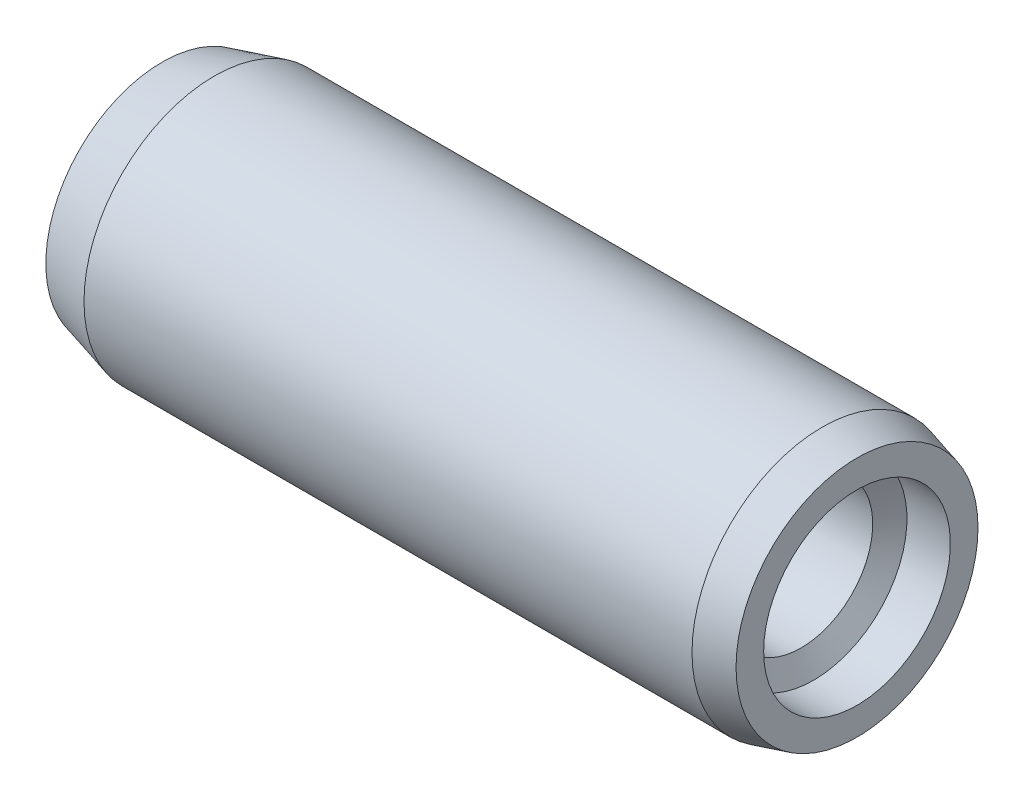
from build123d import *


with BuildPart() as part:
    # Sketch1 → Base-Revolve (revolve)
    with BuildSketch(Plane.XY):
        Polygon((0, 0), (0, 2.678460969), (1.2, 3), (15.2, 3), (16, 2.785640646), (16, 0), align=None)
    revolve(axis=Axis((0, 0, 0), (-1, 0, 0)))

    # Sketch2 → TypeA (revolve, cut)
    with BuildSketch(Plane.XY):
        Polygon((16, 2.15), (15, 2.15), (14.711324865, 1.65), (6, 1.65), (5.047372056, 0), (16, 0), align=None)
    revolve(axis=Axis((16, 0, 0), (1, 0, 0)), mode=Mode.SUBTRACT)


solid = part.part
